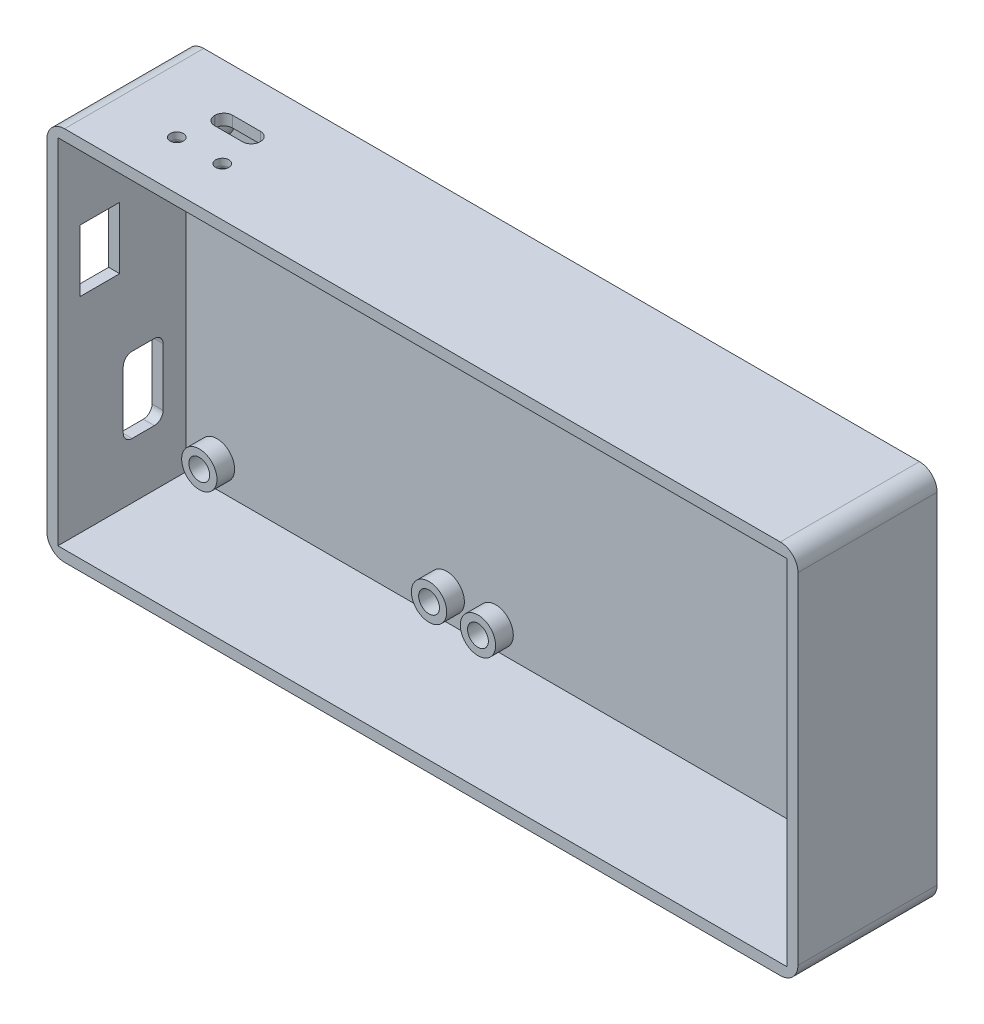
from build123d import *

# Parameters (mm, degrees)
SKETCH_1_W          = 170
SKETCH_1_H          = 85
EXTRUDE_1_DEPTH     = 2.5
SKETCH_2_W          = 170
SKETCH_2_H          = 85
SKETCH_2_W_2        = 165
SKETCH_2_H_2        = 80
EXTRUDE_1_2_DEPTH   = 29
SKETCH_3_R          = 4
EXTRUDE_2_DEPTH     = 4
SKETCH_4_R          = 2.35
CUT_EXTRUDE_1_DEPTH = 6
SKETCH_5_W          = 9.022635
SKETCH_5_H          = 17.078559106
CUT_EXTRUDE_2_DEPTH = 3
SKETCH_6_W          = 10.304284877
SKETCH_6_H          = 4.085444359
CUT_EXTRUDE_3_DEPTH = 3
FILLET_1_R          = 2
FILLET_2_R          = 2
EXTRUDE_START       = 2.5
EXTRUDE_3_OUTLINE_R = 4
EXTRUDE_3_DEPTH     = 4
SKETCH_8_R          = 2.35
CUT_EXTRUDE_4_DEPTH = 5
SKETCH_9_W          = 9
SKETCH_9_H          = 14
CUT_EXTRUDE_5_DEPTH = 5
FILLET_5_R          = 4
SKETCH_10_R         = 1.5
CUT_EXTRUDE_6_DEPTH = 5
FILLET_7_R          = 1
FILLET_8_R          = 1


# Read off the part's stored shape, not the designer's step: Бобышка-Вытянуть3
with BuildPart() as part:
    # Эскиз1 → Extrude 1 (new body)
    with BuildSketch(Plane.XY):
        Rectangle(SKETCH_1_W, SKETCH_1_H)
    extrude(amount=EXTRUDE_1_DEPTH)

    # Эскиз2 → Extrude 1 2 (add)
    with BuildSketch(Plane.XY.offset(2.5)):
        Rectangle(SKETCH_2_W, SKETCH_2_H)
        Rectangle(SKETCH_2_W_2, SKETCH_2_H_2, mode=Mode.SUBTRACT)
    extrude(amount=EXTRUDE_1_2_DEPTH)

    # Эскиз3 → Бобышка-Вытянуть2 (add)
    with BuildSketch(Plane.XY.offset(2.5)):
        with Locations((-75.5, 34)):
            Circle(SKETCH_3_R)
        with Locations((-23.5, 34)):
            Circle(SKETCH_3_R)
        with Locations((-23.5, -34)):
            Circle(SKETCH_3_R)
        with Locations((-75.5, -34)):
            Circle(SKETCH_3_R)
    extrude(amount=EXTRUDE_2_DEPTH)

    # Эскиз4 → Вырез-Вытянуть1 (cut)
    with BuildSketch(Plane.XY.offset(6.5)):
        with Locations((-75.5, 34)):
            Circle(SKETCH_4_R)
        with Locations((-23.5, 34)):
            Circle(SKETCH_4_R)
        with Locations((-75.5, -34)):
            Circle(SKETCH_4_R)
        with Locations((-23.5, -34)):
            Circle(SKETCH_4_R)
    extrude(amount=-CUT_EXTRUDE_1_DEPTH, mode=Mode.SUBTRACT)

    # Эскиз5 → Вырез-Вытянуть2 (cut)
    with BuildSketch(Plane.ZY.offset(85)):
        with Locations((12.205393393, -18.810582789)):
            Rectangle(SKETCH_5_W, SKETCH_5_H)
    extrude(amount=-CUT_EXTRUDE_2_DEPTH, mode=Mode.SUBTRACT)

    # Эскиз6 → Вырез-Вытянуть3 (cut)
    with BuildSketch(Plane(origin=(0, 42.5, 0), x_dir=(1, 0, 0), z_dir=(0, 1, 0))):
        with Locations((-61.466763375, -11.87482218)):
            Rectangle(SKETCH_6_W, SKETCH_6_H)
    extrude(amount=-CUT_EXTRUDE_3_DEPTH, mode=Mode.SUBTRACT)

    # Скругление1
    fillet_1_edges = [part.edges().sort_by_distance(p)[0] for p in [
        (-83.75, -27.349862342, 7.694075893),
        (-83.75, -10.271303236, 7.694075893),
        (-83.75, -10.271303236, 16.716710893),
        (-83.75, -27.349862342, 16.716710893),
    ]]
    fillet(fillet_1_edges, radius=FILLET_1_R)

    # Скругление2
    fillet_2_edges = [part.edges().sort_by_distance(p)[0] for p in [
        (-66.618905813, 41.25, 13.917544359),
        (-66.618905813, 41.25, 9.8321),
        (-56.314620936, 41.25, 9.8321),
        (-56.314620936, 41.25, 13.917544359),
    ]]
    fillet(fillet_2_edges, radius=FILLET_2_R)

    # Бобышка-Вытянуть3 outline → Бобышка-Вытянуть3 (add)
    with BuildSketch(Plane.XY.offset(EXTRUDE_START)):
        with Locations((-12.4283067, 32.990374872)):
            Circle(EXTRUDE_3_OUTLINE_R)
        with Locations((75.5716933, 32.990374872)):
            Circle(EXTRUDE_3_OUTLINE_R)
        with Locations((-12.4283067, -35.009625128)):
            Circle(EXTRUDE_3_OUTLINE_R)
        with Locations((75.5716933, -35.009625128)):
            Circle(EXTRUDE_3_OUTLINE_R)
    extrude(amount=EXTRUDE_3_DEPTH)

    # Эскиз8 → Вырез-Вытянуть4 (cut)
    with BuildSketch(Plane.XY.offset(6.5)):
        with Locations((-12.4283067, -35.009625128)):
            Circle(SKETCH_8_R)
        with Locations((75.5716933, -35.009625128)):
            Circle(SKETCH_8_R)
        with Locations((75.5716933, 32.990374872)):
            Circle(SKETCH_8_R)
        with Locations((-12.4283067, 32.990374872)):
            Circle(SKETCH_8_R)
    extrude(amount=-CUT_EXTRUDE_4_DEPTH, mode=Mode.SUBTRACT)

    # Эскиз9 → Вырез-Вытянуть5 (cut)
    with BuildSketch(Plane.ZY.offset(85)):
        with Locations((22.023559844, 13.353303456)):
            Rectangle(SKETCH_9_W, SKETCH_9_H)
    extrude(amount=-CUT_EXTRUDE_5_DEPTH, mode=Mode.SUBTRACT)

    # Скругление5
    fillet_5_edges = [part.edges().sort_by_distance(p)[0] for p in [
        (85, -42.5, 15.75),
        (-85, -42.5, 15.75),
        (-85, 42.5, 15.75),
        (85, 42.5, 15.75),
    ]]
    fillet(fillet_5_edges, radius=FILLET_5_R)

    # Эскиз10 → Вырез-Вытянуть6 (cut)
    with BuildSketch(Plane(origin=(0, 42.5, 0), x_dir=(1, 0, 0), z_dir=(0, 1, 0))):
        with Locations(Location((-66.618905813, -20.487054891, 0), (0, 0, 270))):
            Circle(SKETCH_10_R)
        with Locations(Location((-56.314620936, -20.487054891, 0), (0, 0, 270))):
            Circle(SKETCH_10_R)
    extrude(amount=-CUT_EXTRUDE_6_DEPTH, mode=Mode.SUBTRACT)

    # Скругление7
    fillet_7_edges = [part.edges().sort_by_distance(p)[0] for p in [
        (-56.314620936, 40, 18.987054891),
    ]]
    fillet(fillet_7_edges, radius=FILLET_7_R)

    # Скругление8
    fillet_8_edges = [part.edges().sort_by_distance(p)[0] for p in [
        (-66.618905813, 40, 18.987054891),
    ]]
    fillet(fillet_8_edges, radius=FILLET_8_R)


solid = part.part
